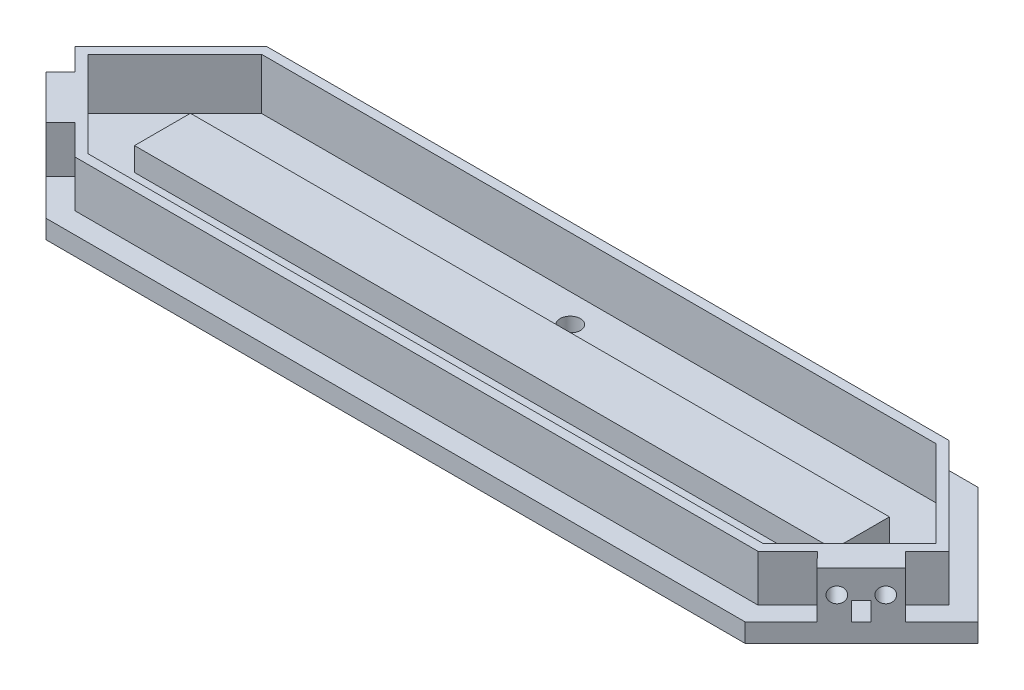
from build123d import *
from build123d.topology import SkipClean

# Parameters (mm, degrees)
SKIZZE1_W                       = 200
SKIZZE1_H                       = 50
AUFSATZ_LINEAR_AUSTRAGEN1_DEPTH = 3
FASE1_SIZE                      = 25
AUFSATZ_LINEAR_AUSTRAGEN2_DEPTH = 11
SKIZZE3_W                       = 15.35533906
SKIZZE3_H                       = 11
SCHNITT_LINEAR_AUSTRAGEN1_DEPTH = 10
SKIZZE4_W                       = 15.35533906
SKIZZE4_H                       = 11
SCHNITT_LINEAR_AUSTRAGEN2_DEPTH = 10
SKIZZE5_W                       = 150
SKIZZE5_H                       = 12
AUFSATZ_LINEAR_AUSTRAGEN3_DEPTH = 5
AUFSATZ_LINEAR_AUSTRAGEN4_DEPTH = 11
AUFSATZ_LINEAR_AUSTRAGEN5_DEPTH = 11
SKIZZE12_R                      = 2.2
SCHNITT_LINEAR_AUSTRAGEN8_DEPTH = 10
AUFSATZ_LINEAR_AUSTRAGEN6_DEPTH = 11
SKIZZE8_R                       = 1.65
SKIZZE8_W                       = 3.016289267
SKIZZE8_H                       = 4
SCHNITT_LINEAR_AUSTRAGEN9_DEPTH = 10
AUFSATZ_LINEAR_AUSTRAGEN7_DEPTH = 1
SKIZZE11_R                      = 1.65
SKIZZE11_W                      = 2.95533906
SKIZZE11_H                      = 4
SCHNITT_LINEAR_AUSTRAGEN7_DEPTH = 10


with BuildPart() as part:
    # Skizze1 → Aufsatz-Linear austragen1 (new body)
    with BuildSketch(Plane(origin=(0, 0, 0), x_dir=(1, 0, 0), z_dir=(0, 1, 0))):
        Rectangle(SKIZZE1_W, SKIZZE1_H)
    extrude(amount=AUFSATZ_LINEAR_AUSTRAGEN1_DEPTH)

    # Fase1
    fase1_edges = [part.edges().sort_by_distance(p)[0] for p in [
        (-100, 1.5, -25),
        (-100, 1.5, 25),
        (100, 1.5, -25),
        (100, 1.5, 25),
    ]]
    chamfer(fase1_edges, length=FASE1_SIZE - 0.0001)  # a hair under: the kernel refuses the full size

    # Skizze2 → Aufsatz-Linear austragen2 (add)
    with BuildSketch(Plane(origin=(0, 3, 0), x_dir=(1, 0, 0), z_dir=(0, 1, 0))):
        Polygon((-73.177460326, 20.6), (-93.777460326, 0), (-73.277460326, -20.5), (73.277460326, -20.5), (93.777460326, 0), (73.177460326, 20.6), align=None)
        Polygon((90.949033201, 0), (72.349033201, 18.6), (-72.349033201, 18.6), (-90.949033201, 0), (-72.449033201, -18.5), (72.449033201, -18.5), align=None, mode=Mode.SUBTRACT)
    extrude(amount=AUFSATZ_LINEAR_AUSTRAGEN2_DEPTH)

    # Skizze3 → Schnitt-Linear austragen1 (cut)
    with BuildSketch(Plane(origin=(-46.888730163, 0, 46.888730163), x_dir=(0.7071067811865476, 0, 0.7071067811865476), z_dir=(-0.7071067811865476, 0, 0.7071067811865476))):
        with Locations((-53.033008589, 8.5)):
            Rectangle(SKIZZE3_W, SKIZZE3_H)
    extrude(amount=-SCHNITT_LINEAR_AUSTRAGEN1_DEPTH, mode=Mode.SUBTRACT)

    # Skizze4 → Schnitt-Linear austragen2 (cut)
    with BuildSketch(Plane(origin=(46.888730163, 0, 46.888730163), x_dir=(0.7071067811865475, 0, -0.7071067811865477), z_dir=(0.7071067811865477, 0, 0.7071067811865475))):
        with Locations((53.033008589, 8.5)):
            Rectangle(SKIZZE4_W, SKIZZE4_H)
    extrude(amount=-SCHNITT_LINEAR_AUSTRAGEN2_DEPTH, mode=Mode.SUBTRACT)

    # Skizze5 → Aufsatz-Linear austragen3 (add)
    with BuildSketch(Plane(origin=(0, 3, 0), x_dir=(1, 0, 0), z_dir=(0, 1, 0))):
        with Locations((-0.006490323, 0)):
            Rectangle(SKIZZE5_W, SKIZZE5_H)
    extrude(amount=AUFSATZ_LINEAR_AUSTRAGEN3_DEPTH)

    # Skizze6 → Aufsatz-Linear austragen4 (add)
    with BuildSketch(Plane(origin=(0, 3, 0), x_dir=(1, 0, 0), z_dir=(0, 1, 0))):
        Polygon((87.696342007, -3.252691193), (78.252691193, -12.696342007), (82.735076288, -17.264923712), (92.221825407, -7.778174593), align=None)
    extrude(amount=AUFSATZ_LINEAR_AUSTRAGEN4_DEPTH)

    # Skizze10 → Aufsatz-Linear austragen5 (add)
    with BuildSketch(Plane(origin=(0, 3, 0), x_dir=(1, 0, 0), z_dir=(0, 1, 0))):
        Polygon((-87.696342007, -3.252691193), (-78.252691193, -12.696342007), (-82.778174593, -17.221825407), (-92.221825407, -7.778174593), align=None)
    extrude(amount=AUFSATZ_LINEAR_AUSTRAGEN5_DEPTH)

    # Skizze12 → Schnitt-Linear austragen8 (cut)
    with BuildSketch(Plane(origin=(0, 3, 0), x_dir=(1, 0, 0), z_dir=(0, 1, 0))):
        with Locations(Location((0, 12.5, 0), (0, 0, 270))):
            Circle(SKIZZE12_R)
        with Locations(Location((0, -12.5, 0), (0, 0, 270))):
            Circle(SKIZZE12_R)
    extrude(amount=-SCHNITT_LINEAR_AUSTRAGEN8_DEPTH, mode=Mode.SUBTRACT)

    # Skizze13 → Aufsatz-Linear austragen6 (add)
    with BuildSketch(Plane(origin=(0, 3, 0), x_dir=(1, 0, 0), z_dir=(0, 1, 0))):
        Polygon((89.817662351, -3.959797975), (88.403448789, -2.545584412), (87.69285367, -3.256179531), (89.107067232, -4.670393094), align=None)
        Polygon((-89.817662351, -3.959797975), (-88.403448789, -2.545584412), (-87.689553601, -3.2594796), (-89.103767163, -4.673693162), align=None)
        Polygon((78.959797975, -14.817662351), (77.545584412, -13.403448789), (78.257117259, -12.691915942), (79.671330821, -14.106129505), align=None)
        Polygon((-78.959797975, -14.817662351), (-77.545584412, -13.403448789), (-78.262212477, -12.686820723), (-79.67642604, -14.101034286), align=None)
    extrude(amount=AUFSATZ_LINEAR_AUSTRAGEN6_DEPTH)

    # Skizze8 → Schnitt-Linear austragen9 (cut)
    with BuildSketch(Plane(origin=(50, 0, 50), x_dir=(0.7071067811865488, 0, -0.7071067811865465), z_dir=(0.7071067811865465, 0, 0.7071067811865488))):
        with Locations((49.294388852, 9)):
            Circle(SKIZZE8_R)
        with Locations((56.710678119, 9)):
            Circle(SKIZZE8_R)
        with Locations((53.002533486, 6)):
            Rectangle(SKIZZE8_W, SKIZZE8_H)
    extrude(amount=-SCHNITT_LINEAR_AUSTRAGEN9_DEPTH, mode=Mode.SUBTRACT)

    # Skizze14 → Aufsatz-Linear austragen7 (add)
    with SkipClean():  # the faces are left unmerged after this step: merging them gives an invalid solid
        with BuildSketch(Plane(origin=(0, 3, 0), x_dir=(1, 0, 0), z_dir=(0, 1, 0))):
            Polygon((-89.11055557, -4.666904756), (-93.777460326, 0), (-73.177460326, 20.6), (73.177460326, 20.6), (93.777460326, 0), (89.11055557, -4.666904756), (92.221825407, -7.778174593), (100, 0), (75, 25), (-75, 25), (-100, 0), (-92.221825407, -7.778174593), align=None)
            Polygon((-82.778174593, -17.221825407), (-79.666904756, -14.11055557), (-73.277460326, -20.5), (73.277460326, -20.5), (79.653436535, -14.12402379), (82.735076288, -17.264923712), (75, -25), (-75, -25), align=None)
        extrude(amount=AUFSATZ_LINEAR_AUSTRAGEN7_DEPTH)

    # Skizze11 → Schnitt-Linear austragen7 (cut)
    with SkipClean():  # the faces are left unmerged after this step: merging them gives an invalid solid
        with BuildSketch(Plane(origin=(-50, 0, 50), x_dir=(0.7071067811865465, 0, 0.7071067811865488), z_dir=(-0.7071067811865488, 0, 0.7071067811865465))):
            with Locations((-56.710678119, 9)):
                Circle(SKIZZE11_R)
            with Locations((-49.355339059, 9)):
                Circle(SKIZZE11_R)
            with Locations((-53.033008589, 6)):
                Rectangle(SKIZZE11_W, SKIZZE11_H)
        extrude(amount=-SCHNITT_LINEAR_AUSTRAGEN7_DEPTH, mode=Mode.SUBTRACT)


solid = part.part
